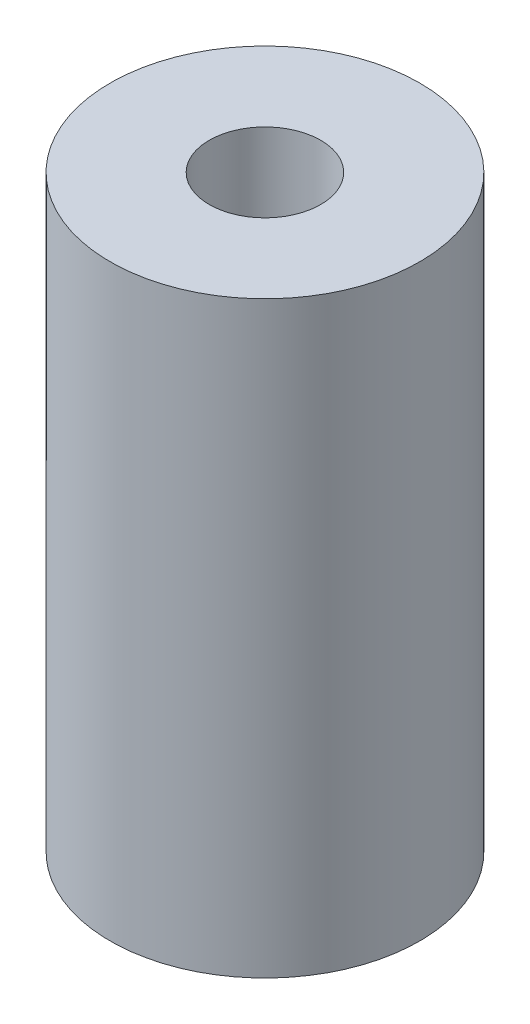
from build123d import *


with BuildPart() as part:
    # Sketch1 → Revolve1 (revolve)
    with BuildSketch(Plane.XY):
        Polygon((-0.9, 9.5), (-0.9, 4), (-1.25, 4), (-1.25, 0), (-2.5, 0), (-2.5, 9.5), align=None)
    revolve(axis=Axis((0, 0, 0), (0, 1, 0)))


solid = part.part
